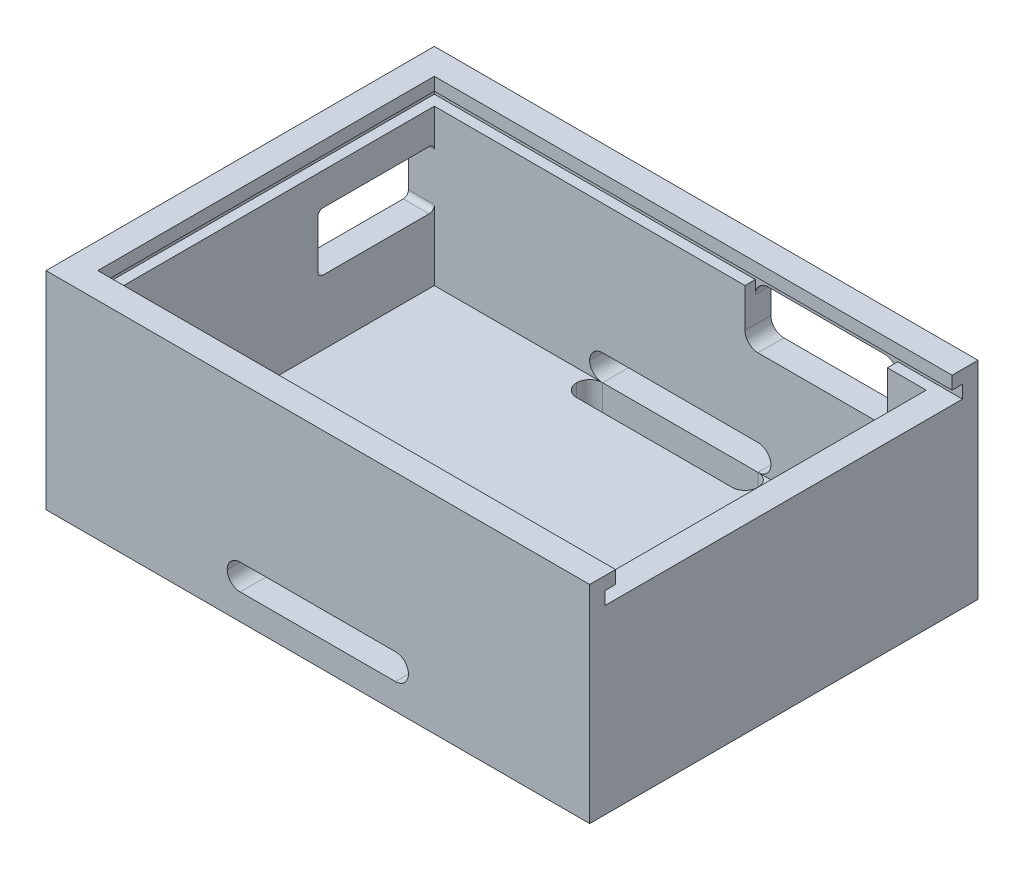
from build123d import *

# Parameters (mm, degrees)
SKETCH_1_W             = 42
SKETCH_1_H             = 30
EXTRUDE_1_DEPTH        = 16
SHELL_1_T              = -2
CUT_EXTRUDE_3_REACH    = 49.381
SKETCH_4_W             = 26
SKETCH_4_H             = 2
SKETCH_5_W             = 27.6
SKETCH_5_H             = 1
CUT_EXTRUDE_4_DEPTH    = 40.8
CUT_EXTRUDE_6_REACH    = 32.364
SKETCH_8_W             = 14
SKETCH_8_H             = 2
CUT_EXTRUDE_7_REACH    = 41.962
SKETCH_9_W             = 14
SKETCH_9_H             = 2
FILLET_3_R             = 1
FILLET_4_R             = 1
FILLET_3_OF_MIRROR_1_R = 1
FILLET_4_OF_MIRROR_1_R = 1
CUT_EXTRUDE_8_REACH    = 49.381
SKETCH_10_W            = 9
SKETCH_10_H            = 4.5
CUT_EXTRUDE_9_REACH    = 41.962
SKETCH_11_W            = 11
SKETCH_11_H            = 4
FILLET_5_R             = 1
FILLET_6_R             = 0.4


# Some blends are built 0.0001 mm under size
with BuildPart() as part:
    # 草图1 → 凸台-拉伸1 (new body)
    with BuildSketch(Plane(origin=(0, 0, 0), x_dir=(1, 0, 0), z_dir=(0, 1, 0))):
        Rectangle(SKETCH_1_W, SKETCH_1_H)
    extrude(amount=EXTRUDE_1_DEPTH)

    # 抽壳1
    shell_1_openings = [part.faces().sort_by_distance(p)[0] for p in [
        (0, 16, 0),
    ]]
    offset(amount=SHELL_1_T, openings=shell_1_openings, kind=Kind.INTERSECTION)

    # 草图4 → 切除-拉伸3 (cut, up to next)
    with BuildSketch(Plane(origin=(21, 0, 0), x_dir=(0, 0, -1), z_dir=(1, 0, 0)), mode=Mode.PRIVATE) as cut_extrude_3_sk1:
        with Locations((0, 15)):
            Rectangle(SKETCH_4_W, SKETCH_4_H)
    cut_extrude_3_tool1 = extrude(cut_extrude_3_sk1.sketch, amount=-CUT_EXTRUDE_3_REACH, mode=Mode.PRIVATE) & part.part
    add(cut_extrude_3_tool1.solids().sort_by_distance((21, 15, 0))[0], mode=Mode.SUBTRACT)

    # 草图5 → 切除-拉伸4 (cut)
    with BuildSketch(Plane(origin=(21, 0, 0), x_dir=(0, 0, -1), z_dir=(1, 0, 0))):
        with Locations((0, 14.5)):
            Rectangle(SKETCH_5_W, SKETCH_5_H)
    extrude(amount=-CUT_EXTRUDE_4_DEPTH, mode=Mode.SUBTRACT)

    # 草图8 → 切除-拉伸6 (cut, up to next)
    with BuildSketch(Plane.XZ, mode=Mode.PRIVATE) as cut_extrude_6_sk1:
        with Locations((0, -12)):
            Rectangle(SKETCH_8_W, SKETCH_8_H)
    cut_extrude_6_tool1 = extrude(cut_extrude_6_sk1.sketch, amount=-CUT_EXTRUDE_6_REACH, mode=Mode.PRIVATE) & part.part
    cut_extrude_6 = cut_extrude_6_tool1.solids().sort_by_distance((0, 0, -12))[0]
    add(cut_extrude_6, mode=Mode.SUBTRACT)

    # 草图9 → 切除-拉伸7 (cut, up to next)
    with BuildSketch(Plane(origin=(0, 0, -15), x_dir=(-1, 0, 0), z_dir=(0, 0, -1)), mode=Mode.PRIVATE) as cut_extrude_7_sk1:
        with Locations((0, 3)):
            Rectangle(SKETCH_9_W, SKETCH_9_H)
    cut_extrude_7_tool1 = extrude(cut_extrude_7_sk1.sketch, amount=-CUT_EXTRUDE_7_REACH, mode=Mode.PRIVATE) & part.part
    cut_extrude_7 = cut_extrude_7_tool1.solids().sort_by_distance((0, 3, -15))[0]
    add(cut_extrude_7, mode=Mode.SUBTRACT)

    # 圆角3
    # the kernel refuses this fillet: 1 mm, written as the material it adds along each edge
    with BuildSketch(Plane(origin=(-7, 4, -15), x_dir=(0, -1, 0), z_dir=(0, 0, 1)), Plane(origin=(-7, 2, -15), x_dir=(1, 0, 0), z_dir=(0, 0, 1)), Plane(origin=(7, 2, -15), x_dir=(0, 1, 0), z_dir=(0, 0, 1))) as fillet_3_piece_1:
        with BuildLine():
            CenterArc((FILLET_3_R, FILLET_3_R), FILLET_3_R, 180, 90)
            Line((0, FILLET_3_R), (0, 0))
            Line((0, 0), (FILLET_3_R, 0))
        make_face()
    extrude(amount=2)
    with BuildSketch(Plane(origin=(7, 4, -15), x_dir=(0, -1, 0), z_dir=(0, 0, 1))) as fillet_3_piece_2:
        with BuildLine():
            CenterArc((FILLET_3_R, -FILLET_3_R), FILLET_3_R, 90, 90)
            Line((0, -FILLET_3_R), (0, 0))
            Line((0, 0), (FILLET_3_R, 0))
        make_face()
    extrude(amount=2)

    # 圆角4
    fillet_4_edges = [part.edges().sort_by_distance(p)[0] for p in [
        (-7, 1, -13),
        (-7, 1, -11),
        (7, 1, -13),
        (7, 1, -11),
    ]]
    fillet(fillet_4_edges, radius=FILLET_4_R - 0.0001)  # a hair under: the kernel refuses the full size

    # 镜向1: 切除-拉伸6, 切除-拉伸7 across plane
    add(cut_extrude_6.mirror(Plane.XY), mode=Mode.SUBTRACT)
    add(cut_extrude_7.mirror(Plane.XY), mode=Mode.SUBTRACT)

    # 圆角3 of 镜向1
    # the kernel refuses this fillet: 1 mm, written as the material it adds along each edge
    with BuildSketch(Plane(origin=(-7, 4, 15), x_dir=(1, 0, 0), z_dir=(0, 0, -1)), Plane(origin=(-7, 2, 15), x_dir=(0, 1, 0), z_dir=(0, 0, -1)), Plane(origin=(7, 2, 15), x_dir=(-1, 0, 0), z_dir=(0, 0, -1))) as fillet_3_of_mirror_1_piece_1:
        with BuildLine():
            CenterArc((FILLET_3_OF_MIRROR_1_R, FILLET_3_OF_MIRROR_1_R), FILLET_3_OF_MIRROR_1_R, 180, 90)
            Line((0, FILLET_3_OF_MIRROR_1_R), (0, 0))
            Line((0, 0), (FILLET_3_OF_MIRROR_1_R, 0))
        make_face()
    extrude(amount=2)
    with BuildSketch(Plane(origin=(7, 4, 15), x_dir=(-1, 0, 0), z_dir=(0, 0, -1))) as fillet_3_of_mirror_1_piece_2:
        with BuildLine():
            CenterArc((FILLET_3_OF_MIRROR_1_R, -FILLET_3_OF_MIRROR_1_R), FILLET_3_OF_MIRROR_1_R, 90, 90)
            Line((0, -FILLET_3_OF_MIRROR_1_R), (0, 0))
            Line((0, 0), (FILLET_3_OF_MIRROR_1_R, 0))
        make_face()
    extrude(amount=2)

    # 圆角4 of 镜向1
    fillet_4_of_mirror_1_edges = [part.edges().sort_by_distance(p)[0] for p in [
        (-7, 1, 13),
        (-7, 1, 11),
        (7, 1, 13),
        (7, 1, 11),
    ]]
    fillet(fillet_4_of_mirror_1_edges, radius=FILLET_4_OF_MIRROR_1_R - 0.0001)  # a hair under: the kernel refuses the full size

    # 草图10 → 切除-拉伸8 (cut, up to next)
    with BuildSketch(Plane.ZY.offset(21), mode=Mode.PRIVATE) as cut_extrude_8_sk1:
        with Locations((-8.5, 9.25)):
            Rectangle(SKETCH_10_W, SKETCH_10_H)
    cut_extrude_8_tool1 = extrude(cut_extrude_8_sk1.sketch, amount=-CUT_EXTRUDE_8_REACH, mode=Mode.PRIVATE) & part.part
    add(cut_extrude_8_tool1.solids().sort_by_distance((-21, 9.25, -8.5))[0], mode=Mode.SUBTRACT)

    # 草图11 → 切除-拉伸9 (cut, up to next)
    with BuildSketch(Plane(origin=(0, 0, -15), x_dir=(-1, 0, 0), z_dir=(0, 0, -1)), mode=Mode.PRIVATE) as cut_extrude_9_sk1:
        with Locations((-10.5, 12)):
            Rectangle(SKETCH_11_W, SKETCH_11_H)
    cut_extrude_9_tool1 = extrude(cut_extrude_9_sk1.sketch, amount=-CUT_EXTRUDE_9_REACH, mode=Mode.PRIVATE) & part.part
    add(cut_extrude_9_tool1.solids().sort_by_distance((10.5, 12, -15))[0], mode=Mode.SUBTRACT)

    # 圆角5
    fillet_5_edges = [part.edges().sort_by_distance(p)[0] for p in [
        (16, 14, -14.4),
        (16, 10, -14),
        (5, 14, -14.4),
        (5, 10, -14),
    ]]
    fillet(fillet_5_edges, radius=FILLET_5_R)

    # 圆角6
    fillet_6_edges = [part.edges().sort_by_distance(p)[0] for p in [
        (-20, 7, -4),
        (-20, 11.5, -4),
        (-20, 11.5, -13),
        (-20, 7, -13),
    ]]
    fillet(fillet_6_edges, radius=FILLET_6_R)


solid = part.part
